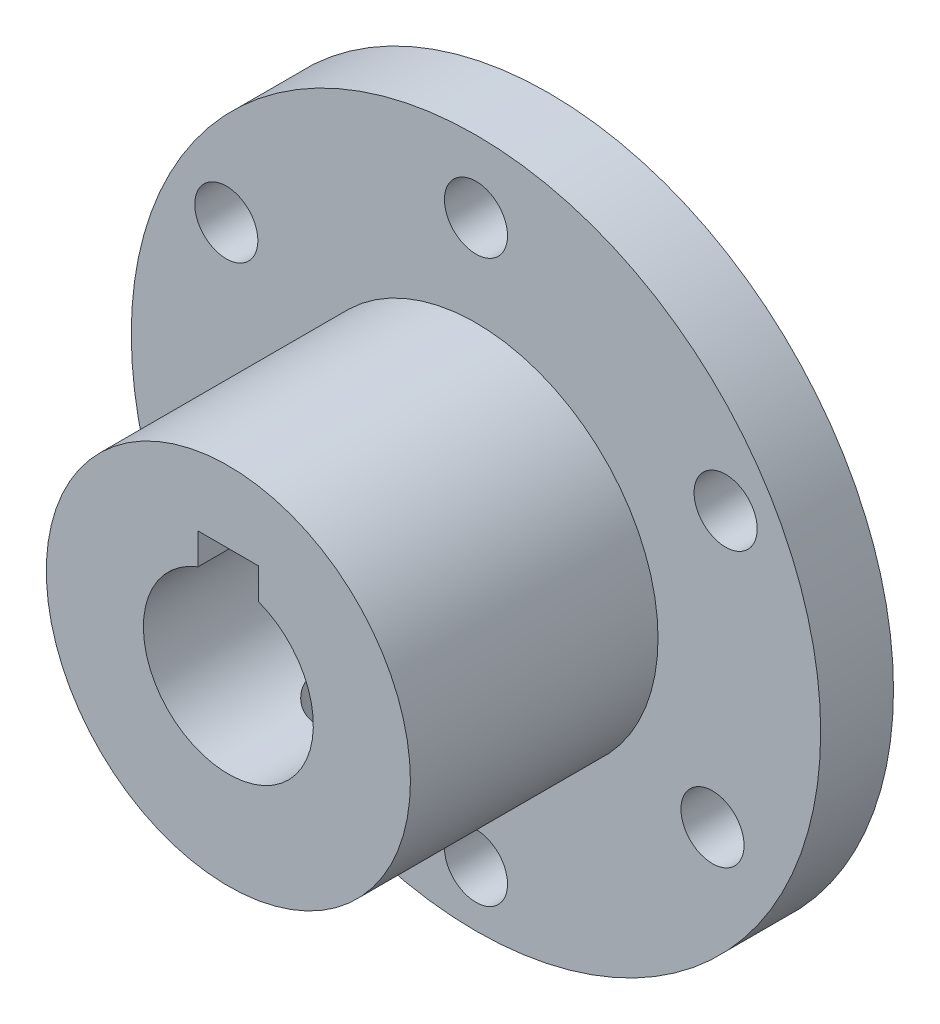
from build123d import *
from build123d.topology import SkipClean

# Parameters (mm, degrees)
SKETCH_1_R          = 15
SKETCH_1_R_2        = 7
EXTRUDE_1_DEPTH     = 20.4
EXTRUDE_START       = 6
SKETCH_2_R          = 28.4
SKETCH_2_R_2        = 7
EXTRUDE_2_DEPTH     = 6
SKETCH_3_R          = 2.6
CUT_EXTRUDE_1_DEPTH = 6
SKETCH_4_W          = 5
SKETCH_4_H          = 4.2
CUT_EXTRUDE_2_DEPTH = 50
SKETCH_5_R          = 3
CUT_EXTRUDE_3_DEPTH = 20.4


with BuildPart() as part:
    # 草图1 → 凸台-拉伸1 (new body)
    with BuildSketch(Plane.XY):
        Circle(SKETCH_1_R)
        Circle(SKETCH_1_R_2, mode=Mode.SUBTRACT)
    extrude(amount=EXTRUDE_1_DEPTH)

    # 草图2 → 凸台-拉伸2 (add)
    with SkipClean():  # the faces are left unmerged after this step: merging them gives an invalid solid
        with BuildSketch(Plane(origin=(0, 0, 0), x_dir=(-1, 0, 0), z_dir=(0, 0, -1)).offset(EXTRUDE_START)):
            Circle(SKETCH_2_R)
            Circle(SKETCH_2_R_2, mode=Mode.SUBTRACT)
        extrude(amount=-EXTRUDE_2_DEPTH)

    # 草图3 → 切除-拉伸1 (cut)
    with SkipClean():  # the faces are left unmerged after this step: merging them gives an invalid solid
        with BuildSketch(Plane.XY):
            with Locations((0, -23.75)):
                Circle(SKETCH_3_R)
            with Locations((-20.56810334, 11.875)):
                Circle(SKETCH_3_R)
            with Locations((20.56810334, 11.875)):
                Circle(SKETCH_3_R)
            with Locations((19.485571585, -11.25)):
                Circle(SKETCH_3_R)
            with Locations((-19.485571585, -11.25)):
                Circle(SKETCH_3_R)
            with Locations((0, 22.5)):
                Circle(SKETCH_3_R)
        extrude(amount=-CUT_EXTRUDE_1_DEPTH, mode=Mode.SUBTRACT)

    # 草图4 → 切除-拉伸2 (cut)
    with SkipClean():  # the faces are left unmerged after this step: merging them gives an invalid solid
        with BuildSketch(Plane.XY.offset(20.4)):
            with Locations((0, 7)):
                Rectangle(SKETCH_4_W, SKETCH_4_H)
        extrude(amount=-CUT_EXTRUDE_2_DEPTH, mode=Mode.SUBTRACT)
    add(part.part.scale(1), mode=Mode.REPLACE)  # the faces are merged on a copy

    # 草图5 → 切除-拉伸3 (cut)
    with BuildSketch(Plane(origin=(0, 0, 0), x_dir=(1, 0, 0), z_dir=(0, 1, 0))):
        with Locations((0, -10.2)):
            Circle(SKETCH_5_R)
    extrude(amount=-CUT_EXTRUDE_3_DEPTH, mode=Mode.SUBTRACT)


solid = part.part
